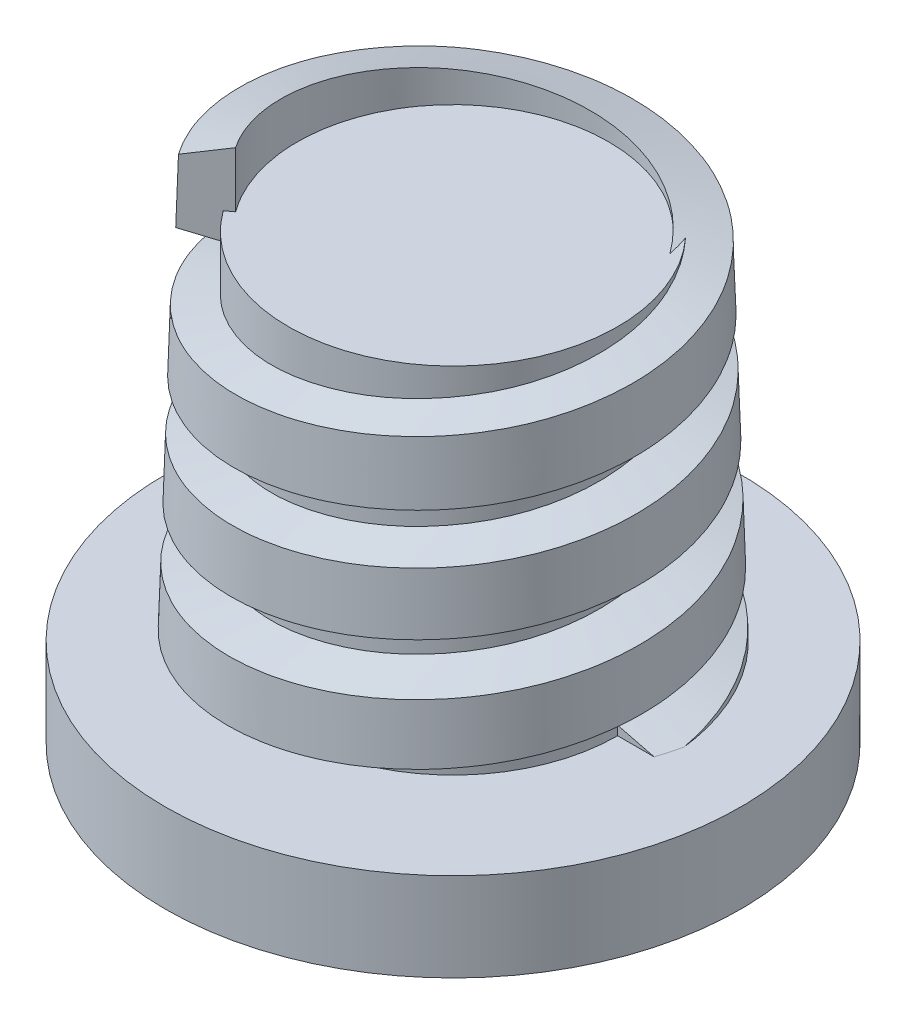
from build123d import *

# Parameters (mm, degrees)
SKETCH1_R           = 6.5
BOSS_EXTRUDE1_DEPTH = 2
SKETCH5_R           = 3.716517187
BOSS_EXTRUDE5_DEPTH = 8
SWEEP1_PITCH        = 2.5


# Read off the part's stored shape, not the designer's step: taper
with BuildPart() as part:
    # Sketch1 → Boss-Extrude1 (new body)
    with BuildSketch(Plane(origin=(0, 0, 0), x_dir=(1, 0, 0), z_dir=(0, 1, 0))):
        with Locations(Location((0, 0, 0), (0, 0, 270))):
            Circle(SKETCH1_R)
    extrude(amount=BOSS_EXTRUDE1_DEPTH)

    # Sketch5 → Boss-Extrude5 (add)
    with BuildSketch(Plane(origin=(0, 2, 0), x_dir=(1, 0, 0), z_dir=(0, 1, 0))):
        with Locations(Location((0, 0, 0), (0, 0, 270))):
            Circle(SKETCH5_R)
    extrude(amount=BOSS_EXTRUDE5_DEPTH)

    # Sweep1: the profile of thread_xsec screwed along a right-hand helix of 3.6 turns, 10 arcs to a turn; built about Z, then put on its axis
    sweep1_z = Axis((0, 0, 0), (0, 0, 1))
    sweep1_corners = [(3.516517187, 0, 0.256155281), (4.716517187, 0, -0.043844719), (4.716517187, 0, -1.356155281), (3.516517187, 0, -1.656155281)]
    with BuildLine(mode=Mode.PRIVATE) as sweep1_profile:
        Line(sweep1_corners[0], sweep1_corners[1])
        Line(sweep1_corners[1], sweep1_corners[2])
        Line(sweep1_corners[2], sweep1_corners[3])
        Line(sweep1_corners[3], sweep1_corners[0])
    sweep1_cap = Face(sweep1_profile.wire())
    sweep1_turn_angles = [0, 18, 36, 54, 72, 90, 108, 126, 144, 162, 180, 198, 216, 234, 252, 270, 288, 306, 324, 342, 360]
    sweep1_turn_weights = [1, 0.9510565162951535, 1, 0.9510565162951535, 1, 0.9510565162951535, 1, 0.9510565162951535, 1, 0.9510565162951535, 1, 0.9510565162951535, 1, 0.9510565162951535, 1, 0.9510565162951535, 1, 0.9510565162951535, 1, 0.9510565162951535, 1]
    sweep1_turn_rails = [Edge.make_bspline([Vector(p[0], p[1], 0).rotate(sweep1_z, sweep1_turn_angles[k]) / sweep1_turn_weights[k] + Vector(0, 0, p[2] + SWEEP1_PITCH * sweep1_turn_angles[k] / 360) for k in range(21)], [0, 0, 0, 1, 1, 2, 2, 3, 3, 4, 4, 5, 5, 6, 6, 7, 7, 8, 8, 9, 9, 10, 10, 10], 2, sweep1_turn_weights) for p in sweep1_corners]
    sweep1_turn_sides = [Face.make_surface_from_curves(sweep1_turn_rails[p[0]], sweep1_turn_rails[p[1]]) for p in [(0, 1), (1, 2), (2, 3), (3, 0)]]
    sweep1_last_angles = [1080, 1098, 1116, 1134, 1152, 1170, 1188, 1206, 1224, 1242, 1260, 1278, 1296]
    sweep1_last_weights = [1, 0.9510565162951535, 1, 0.9510565162951535, 1, 0.9510565162951535, 1, 0.9510565162951535, 1, 0.9510565162951535, 1, 0.9510565162951444, 1]
    sweep1_last_rails = [Edge.make_bspline([Vector(p[0], p[1], 0).rotate(sweep1_z, sweep1_last_angles[k]) / sweep1_last_weights[k] + Vector(0, 0, p[2] + SWEEP1_PITCH * sweep1_last_angles[k] / 360) for k in range(13)], [0, 0, 0, 1, 1, 2, 2, 3, 3, 4, 4, 5, 5, 6, 6, 6], 2, sweep1_last_weights) for p in sweep1_corners]
    sweep1_last_sides = [Face.make_surface_from_curves(sweep1_last_rails[p[0]], sweep1_last_rails[p[1]]) for p in [(0, 1), (1, 2), (2, 3), (3, 0)]]
    sweep1 = Plane(origin=(0, 2, 0), x_dir=(1, 0, 0), z_dir=(0, 1, 0)) * Solid(Shell([*[p.moved(Location((0, 0, SWEEP1_PITCH * i))) for i in range(3) for p in sweep1_turn_sides], *sweep1_last_sides, sweep1_cap, sweep1_cap.rotate(sweep1_z, 1296).moved(Location((0, 0, SWEEP1_PITCH * 1296 / 360)))]))
    add(sweep1)

    # taper outline → taper (revolve, cut)
    with BuildSketch(Plane.XY):
        Polygon((4.716517193, 11.025322509), (4.440768645, 11.025322509), (4.716517193, 1.999999811), align=None)
    revolve(axis=Axis((0, 0, 0), (0, 1, 0)), mode=Mode.SUBTRACT)


solid = part.part
